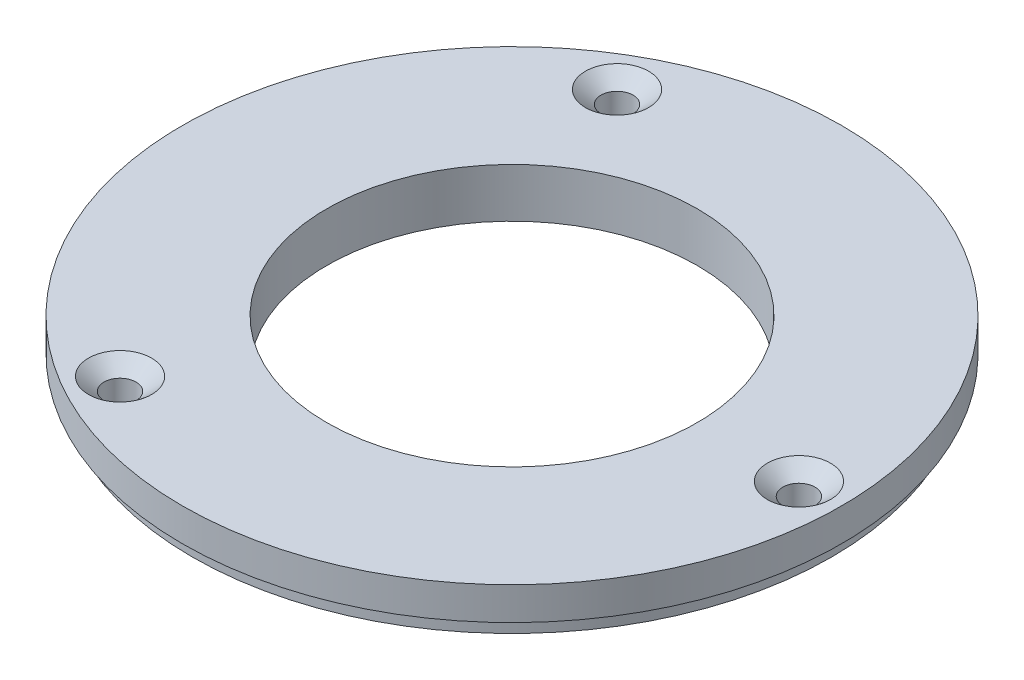
from build123d import *

# Parameters (mm, degrees)
SKETCH1_R                                          = 51.054
SKETCH1_R_2                                        = 28.702
BOSS_EXTRUDE1_DEPTH                                = 7.62
CSK_FOR_10_FLAT_HEAD_MACHINE_SCREW_100_D           = 4.9784
CSK_FOR_10_FLAT_HEAD_MACHINE_SCREW_100_CSINK_D     = 9.779
CSK_FOR_10_FLAT_HEAD_MACHINE_SCREW_100_CSINK_ANGLE = 100
CIRPATTERN1_COUNT                                  = 3
SKETCH6_R                                          = 51.054
SKETCH6_R_2                                        = 49.53
CUT_EXTRUDE1_DEPTH                                 = 2.54


with BuildPart() as part:
    # Sketch1 → Boss-Extrude1 (new body)
    with BuildSketch(Plane(origin=(0, 0, 0), x_dir=(1, 0, 0), z_dir=(0, 1, 0))):
        Circle(SKETCH1_R)
        Circle(SKETCH1_R_2, mode=Mode.SUBTRACT)
    extrude(amount=BOSS_EXTRUDE1_DEPTH)

    # CSK for #10 Flat Head Machine Screw (100)1 (through all)
    with Locations(Plane(origin=(0, 7.62, 0), x_dir=(1, 0, 0), z_dir=(0, 1, 0))):
        with Locations((44.45, 0)):
            csk_for_10_flat_head_machine_screw_100 = CounterSinkHole(CSK_FOR_10_FLAT_HEAD_MACHINE_SCREW_100_D / 2, CSK_FOR_10_FLAT_HEAD_MACHINE_SCREW_100_CSINK_D / 2, counter_sink_angle=CSK_FOR_10_FLAT_HEAD_MACHINE_SCREW_100_CSINK_ANGLE)

    # CirPattern1: CSK for #10 Flat Head Machine Screw (100)1 ×3 about axis
    cirpattern1_axis = Axis((0, 7.62, 0), (0, 1, 0))
    for i in range(1, CIRPATTERN1_COUNT):
        add(csk_for_10_flat_head_machine_screw_100.rotate(cirpattern1_axis, i * 360 / CIRPATTERN1_COUNT), mode=Mode.SUBTRACT)

    # Sketch6 → Cut-Extrude1 (cut)
    with BuildSketch(Plane.XZ):
        Circle(SKETCH6_R)
        Circle(SKETCH6_R_2, mode=Mode.SUBTRACT)
    extrude(amount=-CUT_EXTRUDE1_DEPTH, mode=Mode.SUBTRACT)


solid = part.part
